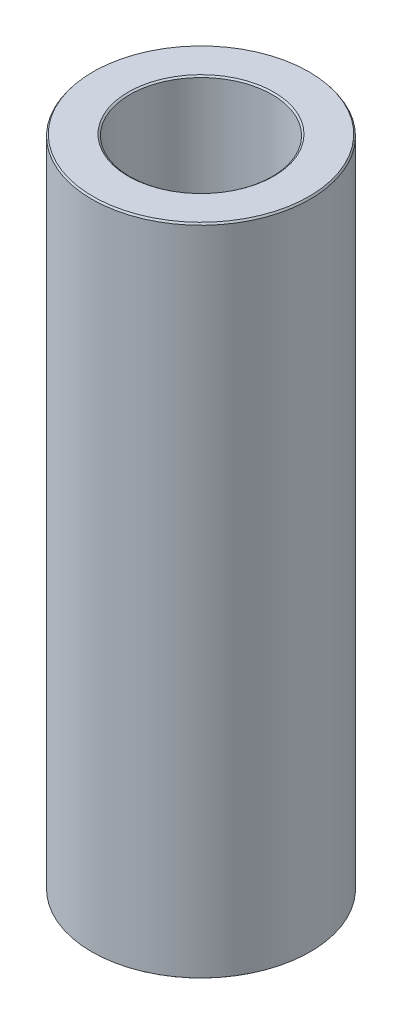
from build123d import *
from OCP.BRepFilletAPI import BRepFilletAPI_MakeChamfer

# Parameters (mm, degrees)
SKETCH1_R           = 50
BOSS_EXTRUDE1_DEPTH = 299.634023245
SKETCH2_R           = 32.55702032
CUT_EXTRUDE1_DEPTH  = 308.864495981
CHAMFER1_SIZE       = 0.78265402
CHAMFER1_SIZE2      = 0.57929425


with BuildPart() as part:
    # Sketch1 → Boss-Extrude1 (new body)
    with BuildSketch(Plane(origin=(0, 0, 0), x_dir=(1, 0, 0), z_dir=(0, 1, 0))):
        Circle(SKETCH1_R)
    extrude(amount=BOSS_EXTRUDE1_DEPTH)

    # Sketch2 → Cut-Extrude1 (cut, through all)
    with BuildSketch(Plane(origin=(0, 0, 0), x_dir=(1, 0, 0), z_dir=(0, 1, 0))):
        Circle(SKETCH2_R)
    extrude(amount=CUT_EXTRUDE1_DEPTH, mode=Mode.SUBTRACT)

    # Chamfer1: one chamfer whose edges measure the first distance from different faces: ONE call of the kernel's chamfer builder (chamfer() names one face for all edges)
    chamfer1_edges_1 = [part.edges().sort_by_distance(p)[0] for p in [
        (-32.55702032, 299.634023245, 0),
    ]]
    chamfer1_side_1 = [part.faces().sort_by_distance(p)[0] for p in [
        (-48.585786438, 299.634023245, 0),
    ]]
    chamfer1_edges_2 = [part.edges().sort_by_distance(p)[0] for p in [
        (-32.55702032, 0, 0),
    ]]
    chamfer1_side_2 = [part.faces().sort_by_distance(p)[0] for p in [
        (-32.55702032, 149.817011622, 0),
    ]]
    chamfer1_edges_3 = [part.edges().sort_by_distance(p)[0] for p in [
        (-50, 0, 0),
    ]]
    chamfer1_side_3 = [part.faces().sort_by_distance(p)[0] for p in [
        (-48.585786438, 0, 0),
    ]]
    chamfer1_edges_4 = [part.edges().sort_by_distance(p)[0] for p in [
        (-50, 299.634023245, 0),
    ]]
    chamfer1_side_4 = [part.faces().sort_by_distance(p)[0] for p in [
        (-50, 149.817011622, 0),
    ]]
    chamfer1 = BRepFilletAPI_MakeChamfer(part.part.solid().wrapped)
    for e in chamfer1_edges_1:
        chamfer1.Add(CHAMFER1_SIZE, CHAMFER1_SIZE2, e.wrapped, chamfer1_side_1[0].wrapped)  # the first distance lies on this face
    for e in chamfer1_edges_2:
        chamfer1.Add(CHAMFER1_SIZE, CHAMFER1_SIZE2, e.wrapped, chamfer1_side_2[0].wrapped)  # the first distance lies on this face
    for e in chamfer1_edges_3:
        chamfer1.Add(CHAMFER1_SIZE, CHAMFER1_SIZE2, e.wrapped, chamfer1_side_3[0].wrapped)  # the first distance lies on this face
    for e in chamfer1_edges_4:
        chamfer1.Add(CHAMFER1_SIZE, CHAMFER1_SIZE2, e.wrapped, chamfer1_side_4[0].wrapped)  # the first distance lies on this face
    add(Compound.cast(chamfer1.Shape()), mode=Mode.REPLACE)


solid = part.part
